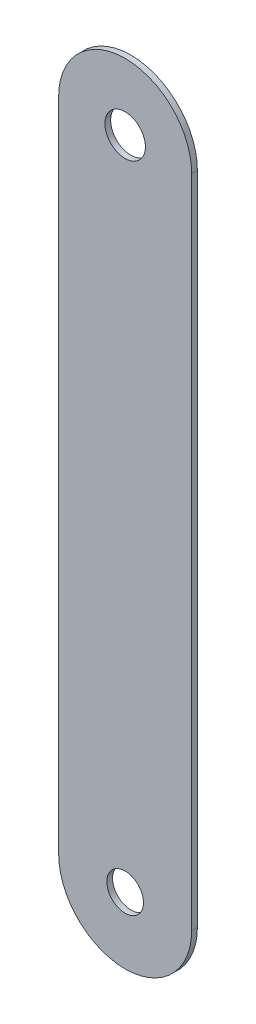
from build123d import *

# Parameters (mm, degrees)
SKETCH1_R          = 2.609641274
SKETCH1_R_2        = 2.36110401
BASE_FLANGE1_DEPTH = 0.7366


# Sheet-metal steps are written as plain solids
with BuildPart() as part:
    # Sketch1 → Base-Flange1 (new body)
    with BuildSketch(Plane.XY):
        with BuildLine():
            Line((8.574535615, 42.127066284), (8.574535615, -42.375603548))
            ThreePointArc((8.574535615, -42.375603548), (0, -50.950139164), (-8.574535615, -42.375603548))
            Line((-8.574535615, -42.375603548), (-8.574535615, 42.127066284))
            ThreePointArc((-8.574535615, 42.127066284), (0, 50.701601899), (8.574535615, 42.127066284))
        make_face()
        with Locations((0, 42.127066284)):
            Circle(SKETCH1_R, mode=Mode.SUBTRACT)
        with Locations((0, -42.375603548)):
            Circle(SKETCH1_R_2, mode=Mode.SUBTRACT)
    extrude(amount=-BASE_FLANGE1_DEPTH)


solid = part.part
